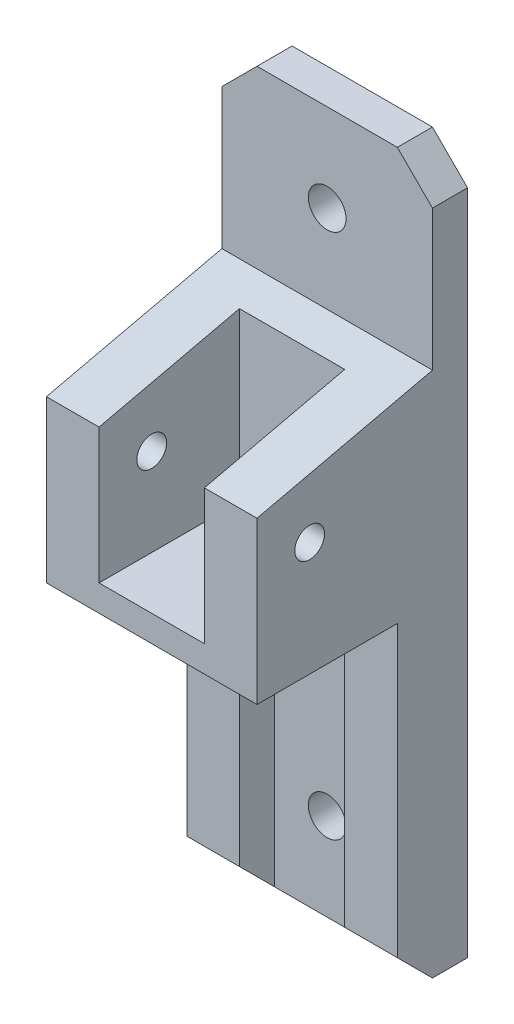
from build123d import *

# Parameters (mm, degrees)
ESQUISSE1_W             = 24
ESQUISSE1_H             = 80
BOSS_EXTRU_1_DEPTH      = 4
ESQUISSE2_W             = 24
ESQUISSE2_H             = 23
BOSS_EXTRU_2_DEPTH      = 4
BOSS_EXTRU_3_DEPTH      = 16
ESQUISSE4_W             = 6
ESQUISSE4_H             = 37
BOSS_EXTRU_4_DEPTH      = 4
CHANFREIN1_SIZE         = 4
CHANFREIN2_SIZE2        = 4.617363823
CHANFREIN2_SIZE         = 20
D_GAGEMENT_M31_D        = 3.4
D_GAGEMENT_M42_D        = 4.3
ESQUISSE11_R            = 3.2
ENL_V_MAT_EXTRU_1_DEPTH = 3


with BuildPart() as part:
    # Esquisse1 → Boss.-Extru.1 (new body)
    with BuildSketch(Plane.XY):
        Rectangle(ESQUISSE1_W, ESQUISSE1_H)
    extrude(amount=BOSS_EXTRU_1_DEPTH)

    # Esquisse2 → Boss.-Extru.2 (add)
    with BuildSketch(Plane.XY.offset(4)):
        with Locations((0, 8.5)):
            Rectangle(ESQUISSE2_W, ESQUISSE2_H)
    extrude(amount=BOSS_EXTRU_2_DEPTH)

    # Esquisse3 → Boss.-Extru.3 (add)
    with BuildSketch(Plane.XY.offset(8)):
        Polygon((-6, 20), (-6, 0), (6, 0), (6, 20), (12, 20), (12, -3), (-12, -3), (-12, 20), align=None)
    extrude(amount=BOSS_EXTRU_3_DEPTH)

    # Esquisse4 → Boss.-Extru.4 (add)
    with BuildSketch(Plane.XY.offset(4)):
        with Locations((-9, -21.5)):
            Rectangle(ESQUISSE4_W, ESQUISSE4_H)
        with Locations((9, -21.5)):
            Rectangle(ESQUISSE4_W, ESQUISSE4_H)
    extrude(amount=BOSS_EXTRU_4_DEPTH)

    # Chanfrein1
    chanfrein1_edges = [part.edges().sort_by_distance(p)[0] for p in [
        (-9, -40, 8),
        (9, -40, 8),
        (12, 40, 2),
        (-12, 40, 2),
    ]]
    chamfer(chanfrein1_edges, length=CHANFREIN1_SIZE)

    # Chanfrein2
    chanfrein2_edges = [part.edges().sort_by_distance(p)[0] for p in [
        (-9, 20, 24),
    ]]
    chanfrein2_side = [part.faces().sort_by_distance(p)[0] for p in [
        (-9, 20, 23.907652724),
    ]]
    chamfer(chanfrein2_edges, length=CHANFREIN2_SIZE - 0.0001, length2=CHANFREIN2_SIZE2 - 0.0001, reference=chanfrein2_side[0])  # a hair under: the kernel refuses the full size

    # Dégagement M31 (through all)
    with Locations(Plane(origin=(12, 0, 0), x_dir=(0, 0, -1), z_dir=(1, 0, 0))):
        with Locations((-18, 10)):
            Hole(D_GAGEMENT_M31_D / 2)

    # Dégagement M42 (through all)
    with Locations(Plane.XY.offset(4)):
        with Locations((0, 30), (0, -30)):
            Hole(D_GAGEMENT_M42_D / 2)

    # Esquisse11 → Enlèv. mat.-Extru.1 (cut)
    with BuildSketch(Plane.ZY.offset(12)):
        with Locations(Location((18, 10, 0), (0, 0, 270))):
            Circle(ESQUISSE11_R)
    extrude(amount=-ENL_V_MAT_EXTRU_1_DEPTH, mode=Mode.SUBTRACT)


solid = part.part
